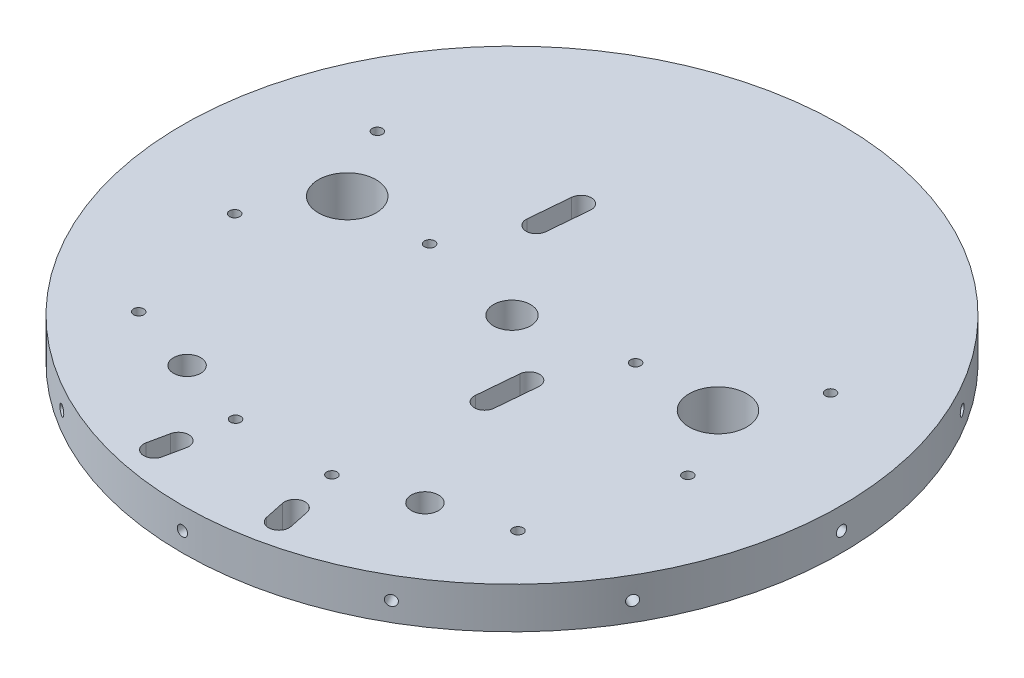
from build123d import *

# Parameters (mm, degrees)
SKETCH1_R           = 80
BOSS_EXTRUDE1_DEPTH = 10
SKETCH3_R           = 4.5
CUT_EXTRUDE1_DEPTH  = 12
SKETCH4_R           = 7
CUT_EXTRUDE2_DEPTH  = 12
SKETCH5_R           = 1.25
CUT_EXTRUDE3_DEPTH  = 15
CIRPATTERN1_COUNT   = 12
CUT_EXTRUDE4_REACH  = 115.578
SKETCH6_R           = 1.25
SKETCH9_R           = 12.5
CUT_EXTRUDE5_DEPTH  = 3
CUT_EXTRUDE6_REACH  = 115.578
SKETCH10_R          = 3.3
CUT_EXTRUDE7_REACH  = 115.578
SKETCH11_R          = 1.25
CUT_EXTRUDE8_REACH  = 115.578
CUT_EXTRUDE10_REACH = 115.578


with BuildPart() as part:
    # Sketch1 → Boss-Extrude1 (new body)
    with BuildSketch(Plane(origin=(0, 0, 0), x_dir=(1, 0, 0), z_dir=(0, 1, 0))):
        Circle(SKETCH1_R)
    extrude(amount=-BOSS_EXTRUDE1_DEPTH)

    # Sketch3 → Cut-Extrude1 (cut)
    with BuildSketch(Plane(origin=(0, 0, 0), x_dir=(1, 0, 0), z_dir=(0, 1, 0))):
        Circle(SKETCH3_R)
    extrude(amount=-CUT_EXTRUDE1_DEPTH, mode=Mode.SUBTRACT)

    # Sketch4 → Cut-Extrude2 (cut)
    with BuildSketch(Plane(origin=(0, 0, 0), x_dir=(1, 0, 0), z_dir=(0, 1, 0))):
        with Locations((-45, 5)):
            Circle(SKETCH4_R)
        with Locations((45, 5)):
            Circle(SKETCH4_R)
    extrude(amount=-CUT_EXTRUDE2_DEPTH, mode=Mode.SUBTRACT)

    # Sketch5 → Cut-Extrude3 (cut)
    with BuildSketch(Plane.XY.offset(80)):
        with Locations((0, -5.323882396)):
            Circle(SKETCH5_R)
    cut_extrude3 = extrude(amount=-CUT_EXTRUDE3_DEPTH, mode=Mode.SUBTRACT)

    # CirPattern1: Cut-Extrude3 ×12 about axis
    cirpattern1_axis = Axis((0, 0, 0), (0, 1, 0))
    for i in range(1, CIRPATTERN1_COUNT):
        add(cut_extrude3.rotate(cirpattern1_axis, i * 360 / CIRPATTERN1_COUNT), mode=Mode.SUBTRACT)

    # Sketch6 → Cut-Extrude4 (cut, up to next)
    with BuildSketch(Plane(origin=(0, 0, 0), x_dir=(1, 0, 0), z_dir=(0, 1, 0)), mode=Mode.PRIVATE) as cut_extrude4_sk1:
        with Locations((-25, 5)):
            Circle(SKETCH6_R)
    cut_extrude4_tool1 = extrude(cut_extrude4_sk1.sketch, amount=-CUT_EXTRUDE4_REACH, mode=Mode.PRIVATE) & part.part
    # Sketch6 → Cut-Extrude4 (cut, up to next)
    with BuildSketch(Plane(origin=(0, 0, 0), x_dir=(1, 0, 0), z_dir=(0, 1, 0)), mode=Mode.PRIVATE) as cut_extrude4_sk2:
        with Locations((25, 5)):
            Circle(SKETCH6_R)
    cut_extrude4_tool2 = extrude(cut_extrude4_sk2.sketch, amount=-CUT_EXTRUDE4_REACH, mode=Mode.PRIVATE) & part.part
    # Sketch6 → Cut-Extrude4 (cut, up to next)
    with BuildSketch(Plane(origin=(0, 0, 0), x_dir=(1, 0, 0), z_dir=(0, 1, 0)), mode=Mode.PRIVATE) as cut_extrude4_sk3:
        with Locations((-55, 22.320508076)):
            Circle(SKETCH6_R)
    cut_extrude4_tool3 = extrude(cut_extrude4_sk3.sketch, amount=-CUT_EXTRUDE4_REACH, mode=Mode.PRIVATE) & part.part
    # Sketch6 → Cut-Extrude4 (cut, up to next)
    with BuildSketch(Plane(origin=(0, 0, 0), x_dir=(1, 0, 0), z_dir=(0, 1, 0)), mode=Mode.PRIVATE) as cut_extrude4_sk4:
        with Locations((-55, -12.320508076)):
            Circle(SKETCH6_R)
    cut_extrude4_tool4 = extrude(cut_extrude4_sk4.sketch, amount=-CUT_EXTRUDE4_REACH, mode=Mode.PRIVATE) & part.part
    # Sketch6 → Cut-Extrude4 (cut, up to next)
    with BuildSketch(Plane(origin=(0, 0, 0), x_dir=(1, 0, 0), z_dir=(0, 1, 0)), mode=Mode.PRIVATE) as cut_extrude4_sk5:
        with Locations((55, 22.320508076)):
            Circle(SKETCH6_R)
    cut_extrude4_tool5 = extrude(cut_extrude4_sk5.sketch, amount=-CUT_EXTRUDE4_REACH, mode=Mode.PRIVATE) & part.part
    # Sketch6 → Cut-Extrude4 (cut, up to next)
    with BuildSketch(Plane(origin=(0, 0, 0), x_dir=(1, 0, 0), z_dir=(0, 1, 0)), mode=Mode.PRIVATE) as cut_extrude4_sk6:
        with Locations((55, -12.320508076)):
            Circle(SKETCH6_R)
    cut_extrude4_tool6 = extrude(cut_extrude4_sk6.sketch, amount=-CUT_EXTRUDE4_REACH, mode=Mode.PRIVATE) & part.part
    add(cut_extrude4_tool1.solids().sort_by_distance((-25, 0, -5))[0], mode=Mode.SUBTRACT)
    add(cut_extrude4_tool2.solids().sort_by_distance((25, 0, -5))[0], mode=Mode.SUBTRACT)
    add(cut_extrude4_tool3.solids().sort_by_distance((-55, 0, -22.320508))[0], mode=Mode.SUBTRACT)
    add(cut_extrude4_tool4.solids().sort_by_distance((-55, 0, 12.320508))[0], mode=Mode.SUBTRACT)
    add(cut_extrude4_tool5.solids().sort_by_distance((55, 0, -22.320508))[0], mode=Mode.SUBTRACT)
    add(cut_extrude4_tool6.solids().sort_by_distance((55, 0, 12.320508))[0], mode=Mode.SUBTRACT)

    # Sketch9 → Cut-Extrude5 (cut)
    with BuildSketch(Plane.XZ.offset(10)):
        Circle(SKETCH9_R)
    extrude(amount=-CUT_EXTRUDE5_DEPTH, mode=Mode.SUBTRACT)

    # Sketch10 → Cut-Extrude6 (cut, up to next)
    with BuildSketch(Plane(origin=(0, 0, 0), x_dir=(1, 0, 0), z_dir=(0, 1, 0)), mode=Mode.PRIVATE) as cut_extrude6_sk1:
        with Locations((28.867513459, -50)):
            Circle(SKETCH10_R)
    cut_extrude6_tool1 = extrude(cut_extrude6_sk1.sketch, amount=-CUT_EXTRUDE6_REACH, mode=Mode.PRIVATE) & part.part
    # Sketch10 → Cut-Extrude6 (cut, up to next)
    with BuildSketch(Plane(origin=(0, 0, 0), x_dir=(1, 0, 0), z_dir=(0, 1, 0)), mode=Mode.PRIVATE) as cut_extrude6_sk2:
        with Locations((-28.867513459, -50)):
            Circle(SKETCH10_R)
    cut_extrude6_tool2 = extrude(cut_extrude6_sk2.sketch, amount=-CUT_EXTRUDE6_REACH, mode=Mode.PRIVATE) & part.part
    add(cut_extrude6_tool1.solids().sort_by_distance((28.867513, 0, 50))[0], mode=Mode.SUBTRACT)
    add(cut_extrude6_tool2.solids().sort_by_distance((-28.867513, 0, 50))[0], mode=Mode.SUBTRACT)

    # Sketch11 → Cut-Extrude7 (cut, up to next)
    with BuildSketch(Plane(origin=(0, 0, 0), x_dir=(1, 0, 0), z_dir=(0, 1, 0)), mode=Mode.PRIVATE) as cut_extrude7_sk1:
        with Locations((11.700608346, -55.412704391)):
            Circle(SKETCH11_R)
    cut_extrude7_tool1 = extrude(cut_extrude7_sk1.sketch, amount=-CUT_EXTRUDE7_REACH, mode=Mode.PRIVATE) & part.part
    # Sketch11 → Cut-Extrude7 (cut, up to next)
    with BuildSketch(Plane(origin=(0, 0, 0), x_dir=(1, 0, 0), z_dir=(0, 1, 0)), mode=Mode.PRIVATE) as cut_extrude7_sk2:
        with Locations((-11.700608346, -55.412704391)):
            Circle(SKETCH11_R)
    cut_extrude7_tool2 = extrude(cut_extrude7_sk2.sketch, amount=-CUT_EXTRUDE7_REACH, mode=Mode.PRIVATE) & part.part
    # Sketch11 → Cut-Extrude7 (cut, up to next)
    with BuildSketch(Plane(origin=(0, 0, 0), x_dir=(1, 0, 0), z_dir=(0, 1, 0)), mode=Mode.PRIVATE) as cut_extrude7_sk3:
        with Locations((46.034418573, -44.587295609)):
            Circle(SKETCH11_R)
    cut_extrude7_tool3 = extrude(cut_extrude7_sk3.sketch, amount=-CUT_EXTRUDE7_REACH, mode=Mode.PRIVATE) & part.part
    # Sketch11 → Cut-Extrude7 (cut, up to next)
    with BuildSketch(Plane(origin=(0, 0, 0), x_dir=(1, 0, 0), z_dir=(0, 1, 0)), mode=Mode.PRIVATE) as cut_extrude7_sk4:
        with Locations((-46.034418573, -44.587295609)):
            Circle(SKETCH11_R)
    cut_extrude7_tool4 = extrude(cut_extrude7_sk4.sketch, amount=-CUT_EXTRUDE7_REACH, mode=Mode.PRIVATE) & part.part
    add(cut_extrude7_tool1.solids().sort_by_distance((11.700608, 0, 55.412704))[0], mode=Mode.SUBTRACT)
    add(cut_extrude7_tool2.solids().sort_by_distance((-11.700608, 0, 55.412704))[0], mode=Mode.SUBTRACT)
    add(cut_extrude7_tool3.solids().sort_by_distance((46.034419, 0, 44.587296))[0], mode=Mode.SUBTRACT)
    add(cut_extrude7_tool4.solids().sort_by_distance((-46.034419, 0, 44.587296))[0], mode=Mode.SUBTRACT)

    # Sketch12 → Cut-Extrude8 (cut, up to next)
    with BuildSketch(Plane(origin=(0, 0, 0), x_dir=(1, 0, 0), z_dir=(0, 1, 0)), mode=Mode.PRIVATE) as cut_extrude8_sk1:
        with BuildLine():
            Line((16.560305659, -66.326889066), (17.593297776, -71.219018182))
            ThreePointArc((17.593297776, -71.219018182), (15.663729276, -74.181578798), (12.701168659, -72.252010298))
            Line((12.701168659, -72.252010298), (11.668176543, -67.359881182))
            ThreePointArc((11.668176543, -67.359881182), (13.597745043, -64.397320566), (16.560305659, -66.326889066))
        make_face()
    cut_extrude8_tool1 = extrude(cut_extrude8_sk1.sketch, amount=-CUT_EXTRUDE8_REACH, mode=Mode.PRIVATE) & part.part
    # Sketch12 → Cut-Extrude8 (cut, up to next)
    with BuildSketch(Plane(origin=(0, 0, 0), x_dir=(1, 0, 0), z_dir=(0, 1, 0)), mode=Mode.PRIVATE) as cut_extrude8_sk2:
        with BuildLine():
            Line((-11.668176543, -67.359881182), (-12.701168659, -72.252010298))
            ThreePointArc((-12.701168659, -72.252010298), (-15.663729276, -74.181578798), (-17.593297776, -71.219018182))
            Line((-17.593297776, -71.219018182), (-16.560305659, -66.326889066))
            ThreePointArc((-16.560305659, -66.326889066), (-13.597745043, -64.397320566), (-11.668176543, -67.359881182))
        make_face()
    cut_extrude8_tool2 = extrude(cut_extrude8_sk2.sketch, amount=-CUT_EXTRUDE8_REACH, mode=Mode.PRIVATE) & part.part
    add(cut_extrude8_tool1.solids().sort_by_distance((14.630737, 0, 69.28945))[0], mode=Mode.SUBTRACT)
    add(cut_extrude8_tool2.solids().sort_by_distance((-14.630737, 0, 69.28945))[0], mode=Mode.SUBTRACT)

    # Sketch13 → Cut-Extrude10 (cut, up to next)
    with BuildSketch(Plane(origin=(0, 0, 0), x_dir=(1, 0, 0), z_dir=(0, 1, 0)), mode=Mode.PRIVATE) as cut_extrude10_sk1:
        with BuildLine():
            Line((17.38483505, -21.751421731), (18.256392478, -11.78947475))
            ThreePointArc((18.256392478, -11.78947475), (15.98379509, -9.081098648), (13.275418987, -11.353696036))
            Line((13.275418987, -11.353696036), (12.40386156, -21.315643017))
            ThreePointArc((12.40386156, -21.315643017), (14.676458948, -24.024019119), (17.38483505, -21.751421731))
        make_face()
    cut_extrude10_tool1 = extrude(cut_extrude10_sk1.sketch, amount=-CUT_EXTRUDE10_REACH, mode=Mode.PRIVATE) & part.part
    # Sketch13 → Cut-Extrude10 (cut, up to next)
    with BuildSketch(Plane(origin=(0, 0, 0), x_dir=(1, 0, 0), z_dir=(0, 1, 0)), mode=Mode.PRIVATE) as cut_extrude10_sk2:
        with BuildLine():
            Line((-13.227402612, 24.138411415), (-12.573734541, 31.609871651))
            ThreePointArc((-12.573734541, 31.609871651), (-14.846331929, 34.318247753), (-17.554708031, 32.045650365))
            Line((-17.554708031, 32.045650365), (-18.426265459, 22.083703384))
            ThreePointArc((-18.426265459, 22.083703384), (-16.153668071, 19.375327282), (-13.445291969, 21.64792467))
            Line((-13.445291969, 21.64792467), (-13.227402612, 24.138411415))
        make_face()
    cut_extrude10_tool2 = extrude(cut_extrude10_sk2.sketch, amount=-CUT_EXTRUDE10_REACH, mode=Mode.PRIVATE) & part.part
    add(cut_extrude10_tool1.solids().sort_by_distance((15.330127, 0, 16.552559))[0], mode=Mode.SUBTRACT)
    add(cut_extrude10_tool2.solids().sort_by_distance((-15.5, 0, -26.846788))[0], mode=Mode.SUBTRACT)


solid = part.part
